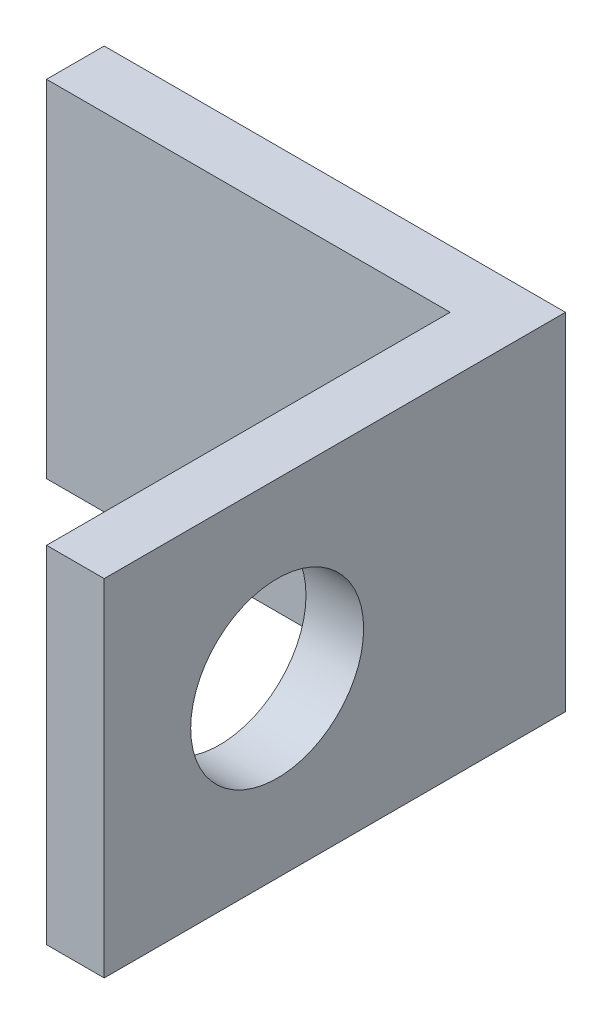
from build123d import *

# Parameters (mm, degrees)
BOSS_EXTRUDE1_DEPTH            = 9.525
F_3_16_0_1875_DIAMETER_HOLE1_D = 4.7625


with BuildPart() as part:
    # Sketch1 → Boss-Extrude1 (new body)
    with BuildSketch(Plane(origin=(0, 0, 0), x_dir=(1, 0, 0), z_dir=(0, 1, 0))):
        Polygon((0, 0), (12.7, 0), (12.7, -12.7), (11.1125, -12.7), (11.1125, -1.5875), (0, -1.5875), align=None)
    extrude(amount=BOSS_EXTRUDE1_DEPTH)

    # 3/16 (0.1875) Diameter Hole1 (through all)
    with Locations(Plane.ZY.offset(-11.1125)):
        with Locations((7.9375, 4.7625)):
            Hole(F_3_16_0_1875_DIAMETER_HOLE1_D / 2)


solid = part.part
